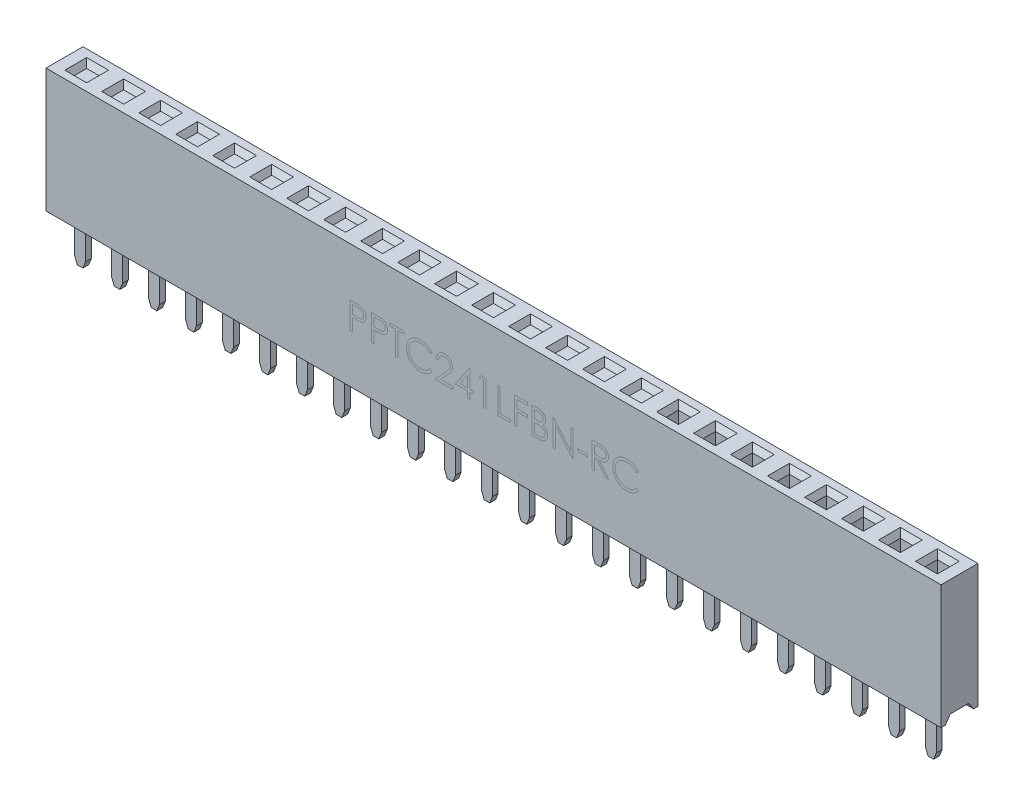
from build123d import *

# Parameters (mm, degrees)
BOSS_EXTRUDE1_DEPTH = 30.73
BOSS_EXTRUDE2_DEPTH = 0.2
LPATTERN1_COUNT     = 24
LPATTERN1_PITCH     = 2.54
LPATTERN2_COUNT     = 24
LPATTERN2_PITCH     = 2.54
SKETCH8_W           = 1
SKETCH8_H           = 1
CUT_EXTRUDE1_DEPTH  = 6


with BuildPart() as part:
    # Sketch1 → Boss-Extrude1 (new, symmetric)
    with BuildSketch(Plane(origin=(0, 0, 0), x_dir=(0, 0, -1), z_dir=(1, 0, 0))):
        Polygon((-1.27, 4.250000098), (1.27, 4.250000098), (1.27, -4.249999902), (0.97, -4.249999902), (0.633780518, -3.749999902), (-0.633780518, -3.749999902), (-0.97, -4.250000098), (-1.27, -4.250000098), align=None)
    extrude(amount=BOSS_EXTRUDE1_DEPTH, both=True)

    # Sketch5 → Cut-Loft1 section 0
    with BuildSketch(Plane(origin=(0, 4.250000098, 0), x_dir=(1, 0, 0), z_dir=(0, 1, 0))):
        with BuildLine():
            Line((28.46, 0.75), (29.96, 0.75))
            Line((29.96, 0.75), (29.96, -0.75))
            Line((29.96, -0.75), (28.46, -0.75))
            Line((28.46, -0.75), (28.46, 0.75))
        make_face()
    # Sketch6 → Cut-Loft1 section 1
    with BuildSketch(Plane(origin=(0, 3.850000098, 0), x_dir=(1, 0, 0), z_dir=(0, 1, 0))):
        with BuildLine():
            Line((29.71, -0.5), (29.71, 0.5))
            Line((29.71, 0.5), (28.71, 0.5))
            Line((28.71, 0.5), (28.71, -0.5))
            Line((28.71, -0.5), (29.71, -0.5))
        make_face()
    cut_loft1 = loft(mode=Mode.SUBTRACT)

    # LPattern2: Cut-Loft1 ×24
    with Locations(*[(-i * LPATTERN2_PITCH, 0, 0) for i in range(1, LPATTERN2_COUNT)]):
        add(cut_loft1, mode=Mode.SUBTRACT)

    # Sketch8 → Cut-Extrude1 (cut)
    with BuildSketch(Plane(origin=(0, 3.850000098, 0), x_dir=(1, 0, 0), z_dir=(0, 1, 0))):
        with Locations((26.67, 0)):
            Rectangle(SKETCH8_W, SKETCH8_H)
        with Locations((29.21, 0)):
            Rectangle(SKETCH8_W, SKETCH8_H)
        with Locations((24.13, 0)):
            Rectangle(SKETCH8_W, SKETCH8_H)
        with Locations((21.59, 0)):
            Rectangle(SKETCH8_W, SKETCH8_H)
        with Locations((19.05, 0)):
            Rectangle(SKETCH8_W, SKETCH8_H)
        with Locations((16.51, 0)):
            Rectangle(SKETCH8_W, SKETCH8_H)
        with Locations((13.97, 0)):
            Rectangle(SKETCH8_W, SKETCH8_H)
        with Locations((11.43, 0)):
            Rectangle(SKETCH8_W, SKETCH8_H)
    extrude(amount=-CUT_EXTRUDE1_DEPTH, mode=Mode.SUBTRACT)


with BuildPart() as body_2:
    # Sketch4 → Boss-Extrude2 (new, symmetric)
    with BuildSketch(Plane.XY):
        Polygon((-29.266747653, -7.450000098), (-29.653252347, -7.450000098), (-29.835, -6.984202083), (-29.835, -3.750000098), (-29.085, -3.750000098), (-29.085, -6.984202083), align=None)
    extrude(amount=BOSS_EXTRUDE2_DEPTH, both=True)


with BuildPart() as lpattern1_1:
    # LPattern1: pattern copy
    add(body_2.part.moved(Location(Vector(1, 0, 0) * (1 * LPATTERN1_PITCH))))


with BuildPart() as lpattern1_2:
    # LPattern1: pattern copy
    add(body_2.part.moved(Location(Vector(1, 0, 0) * (2 * LPATTERN1_PITCH))))


with BuildPart() as lpattern1_3:
    # LPattern1: pattern copy
    add(body_2.part.moved(Location(Vector(1, 0, 0) * (3 * LPATTERN1_PITCH))))


with BuildPart() as lpattern1_4:
    # LPattern1: pattern copy
    add(body_2.part.moved(Location(Vector(1, 0, 0) * (4 * LPATTERN1_PITCH))))


with BuildPart() as lpattern1_5:
    # LPattern1: pattern copy
    add(body_2.part.moved(Location(Vector(1, 0, 0) * (5 * LPATTERN1_PITCH))))


with BuildPart() as lpattern1_6:
    # LPattern1: pattern copy
    add(body_2.part.moved(Location(Vector(1, 0, 0) * (6 * LPATTERN1_PITCH))))


with BuildPart() as lpattern1_7:
    # LPattern1: pattern copy
    add(body_2.part.moved(Location(Vector(1, 0, 0) * (7 * LPATTERN1_PITCH))))


with BuildPart() as lpattern1_8:
    # LPattern1: pattern copy
    add(body_2.part.moved(Location(Vector(1, 0, 0) * (8 * LPATTERN1_PITCH))))


with BuildPart() as lpattern1_9:
    # LPattern1: pattern copy
    add(body_2.part.moved(Location(Vector(1, 0, 0) * (9 * LPATTERN1_PITCH))))


with BuildPart() as lpattern1_10:
    # LPattern1: pattern copy
    add(body_2.part.moved(Location(Vector(1, 0, 0) * (10 * LPATTERN1_PITCH))))


with BuildPart() as lpattern1_11:
    # LPattern1: pattern copy
    add(body_2.part.moved(Location(Vector(1, 0, 0) * (11 * LPATTERN1_PITCH))))


with BuildPart() as lpattern1_12:
    # LPattern1: pattern copy
    add(body_2.part.moved(Location(Vector(1, 0, 0) * (12 * LPATTERN1_PITCH))))


with BuildPart() as lpattern1_13:
    # LPattern1: pattern copy
    add(body_2.part.moved(Location(Vector(1, 0, 0) * (13 * LPATTERN1_PITCH))))


with BuildPart() as lpattern1_14:
    # LPattern1: pattern copy
    add(body_2.part.moved(Location(Vector(1, 0, 0) * (14 * LPATTERN1_PITCH))))


with BuildPart() as lpattern1_15:
    # LPattern1: pattern copy
    add(body_2.part.moved(Location(Vector(1, 0, 0) * (15 * LPATTERN1_PITCH))))


with BuildPart() as lpattern1_16:
    # LPattern1: pattern copy
    add(body_2.part.moved(Location(Vector(1, 0, 0) * (16 * LPATTERN1_PITCH))))


with BuildPart() as lpattern1_17:
    # LPattern1: pattern copy
    add(body_2.part.moved(Location(Vector(1, 0, 0) * (17 * LPATTERN1_PITCH))))


with BuildPart() as lpattern1_18:
    # LPattern1: pattern copy
    add(body_2.part.moved(Location(Vector(1, 0, 0) * (18 * LPATTERN1_PITCH))))


with BuildPart() as lpattern1_19:
    # LPattern1: pattern copy
    add(body_2.part.moved(Location(Vector(1, 0, 0) * (19 * LPATTERN1_PITCH))))


with BuildPart() as lpattern1_20:
    # LPattern1: pattern copy
    add(body_2.part.moved(Location(Vector(1, 0, 0) * (20 * LPATTERN1_PITCH))))


with BuildPart() as lpattern1_21:
    # LPattern1: pattern copy
    add(body_2.part.moved(Location(Vector(1, 0, 0) * (21 * LPATTERN1_PITCH))))


with BuildPart() as lpattern1_22:
    # LPattern1: pattern copy
    add(body_2.part.moved(Location(Vector(1, 0, 0) * (22 * LPATTERN1_PITCH))))


with BuildPart() as lpattern1_23:
    # LPattern1: pattern copy
    add(body_2.part.moved(Location(Vector(1, 0, 0) * (23 * LPATTERN1_PITCH))))


solid = Compound([part.part, body_2.part, lpattern1_1.part, lpattern1_2.part, lpattern1_3.part, lpattern1_4.part, lpattern1_5.part, lpattern1_6.part, lpattern1_7.part, lpattern1_8.part, lpattern1_9.part, lpattern1_10.part, lpattern1_11.part, lpattern1_12.part, lpattern1_13.part, lpattern1_14.part, lpattern1_15.part, lpattern1_16.part, lpattern1_17.part, lpattern1_18.part, lpattern1_19.part, lpattern1_20.part, lpattern1_21.part, lpattern1_22.part, lpattern1_23.part])
